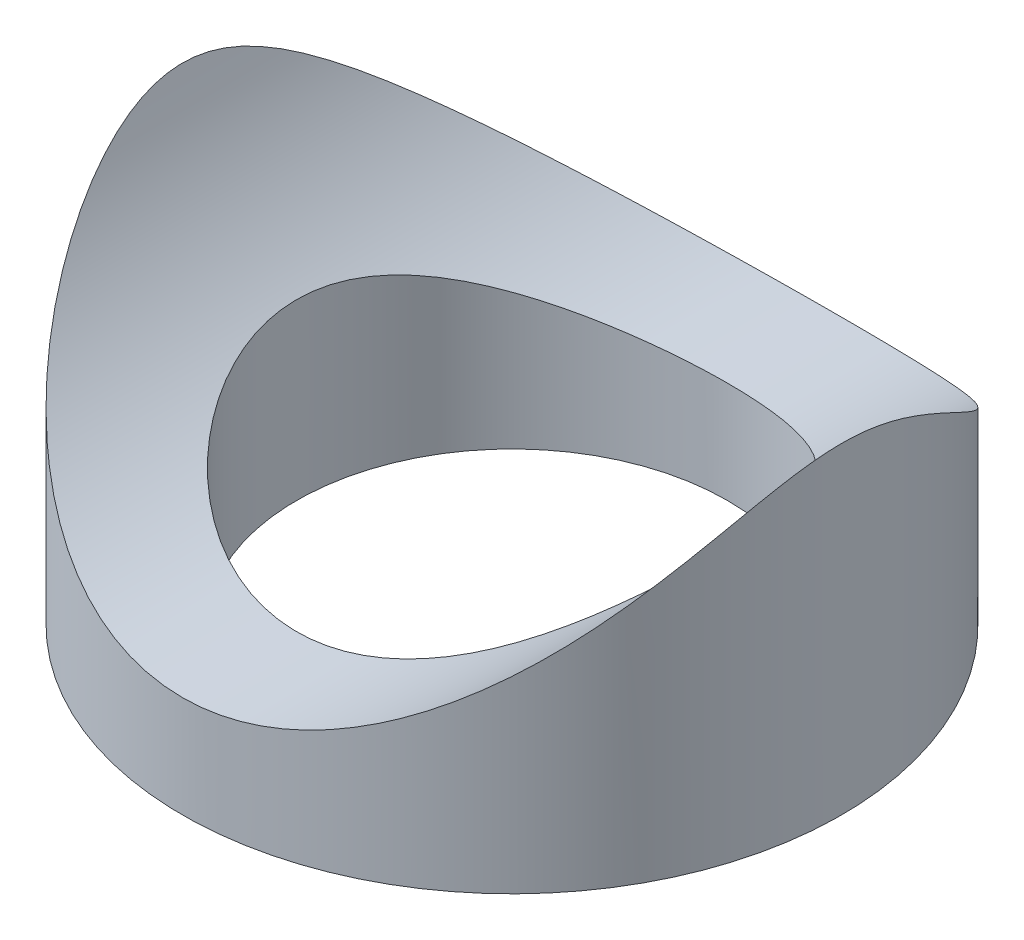
from build123d import *

# Parameters (mm, degrees)
SKETCH1_R               = 7.65
SKETCH1_R_2             = 5
BOSS_EXTRUDE1_DEPTH     = 10
CUT_EXTRUDE1_DEPTH      = 15.732447183
CUT_EXTRUDE1_DEPTH_BACK = 15.732447183
SKETCH2_R               = 8.28
BOSS_EXTRUDE2_START     = 1
SKETCH3_R               = 7.65
SKETCH3_R_2             = 5
BOSS_EXTRUDE2_DEPTH     = 1


with BuildPart() as part:
    # Sketch1 → Boss-Extrude1 (new body)
    with BuildSketch(Plane(origin=(0, 0, 0), x_dir=(1, 0, 0), z_dir=(0, 1, 0))):
        Circle(SKETCH1_R)
        Circle(SKETCH1_R_2, mode=Mode.SUBTRACT)
    extrude(amount=BOSS_EXTRUDE1_DEPTH)

    # Sketch2 → Cut-Extrude1 (cut, two sides: drawn at the far end of the back side and taken through both)
    with BuildSketch(Plane.XY.offset(-CUT_EXTRUDE1_DEPTH_BACK)):
        with Locations((0, 9.64)):
            Circle(SKETCH2_R)
    extrude(amount=CUT_EXTRUDE1_DEPTH + CUT_EXTRUDE1_DEPTH_BACK, mode=Mode.SUBTRACT)

    # Sketch3 → Boss-Extrude2 (add)
    with BuildSketch(Plane.XZ.offset(BOSS_EXTRUDE2_START)):
        Circle(SKETCH3_R)
        Circle(SKETCH3_R_2, mode=Mode.SUBTRACT)
    extrude(amount=-BOSS_EXTRUDE2_DEPTH)


solid = part.part
